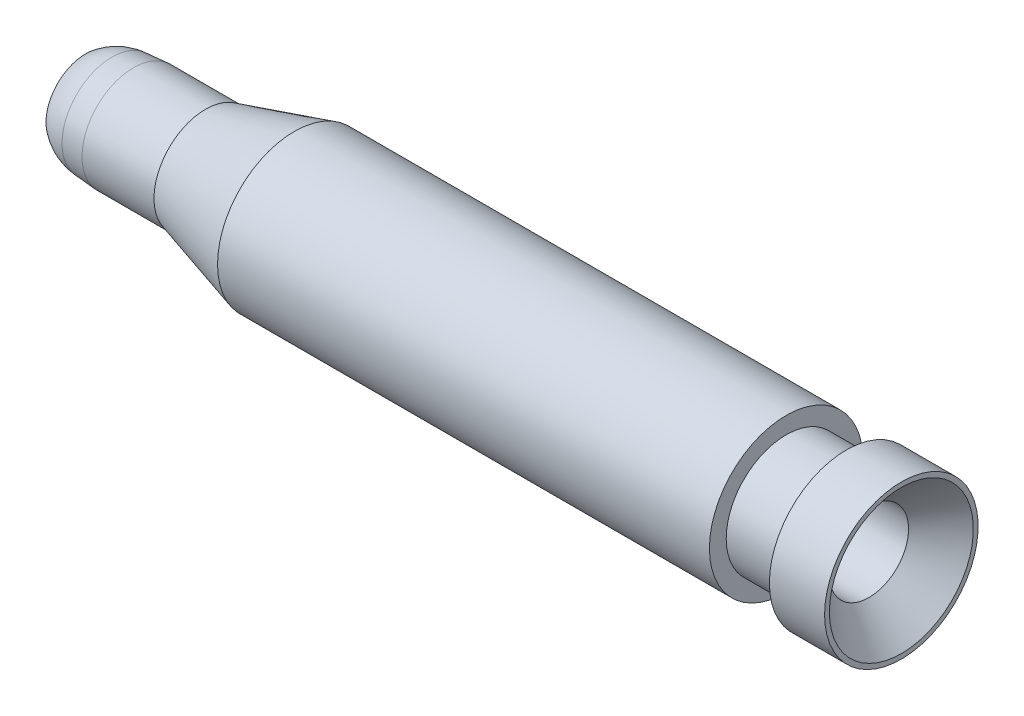
from build123d import *

# Parameters (mm, degrees)
FILETE3_R     = 4
CHANFRO7_SIZE = 2.7


with BuildPart() as part:
    # Esboço1 → Revolução1 (revolve)
    with BuildSketch(Plane.XY, mode=Mode.PRIVATE) as revolu_o1_sk:
        Polygon((0, 3.3), (0, 4), (4, 4.3), (10, 4.3), (17.4, 6.4), (58.4, 6.4), (58.4, 5), (63.4, 5), (63.4, 6.4), (68, 6.4), (68, 3.3), align=None)
    revolve(revolu_o1_sk.sketch.rotate(Axis((0, 0, 0), (1, 0, 0)), 90), axis=Axis((0, 0, 0), (1, 0, 0)))

    # Filete3
    # the kernel refuses this fillet: 4 mm, written as the material it takes off along each edge
    with BuildSketch(Plane(origin=(0, 0, 0), x_dir=(0, 0, 1), z_dir=(0, 1, 0))) as filete3_piece_1:
        with BuildLine():
            CenterArc((0.176138028, 2.498296696), FILETE3_R, 321.349060222, 34.361786449)
            Line((4.164935268, 2.199136903), (4.244711213, 2.193153707))
            Line((4.244711213, 2.193153707), (4.079775945, -0.005983196))
            Line((4.079775945, -0.005983196), (4, -0.08))
            ThreePointArc((4, -0.08), (3.65, -0.08), (3.362477239, -0.049965934))
            Line((3.362477239, -0.049965934), (3.3, 0))
        make_face()
    revolve(axis=Axis((0, 0, 0), (1, 0, 0)), mode=Mode.SUBTRACT)

    # Chanfro7
    chanfro7_edges = [part.edges().sort_by_distance(p)[0] for p in [
        (68, 0, -3.3),
    ]]
    chamfer(chanfro7_edges, length=CHANFRO7_SIZE)


solid = part.part
